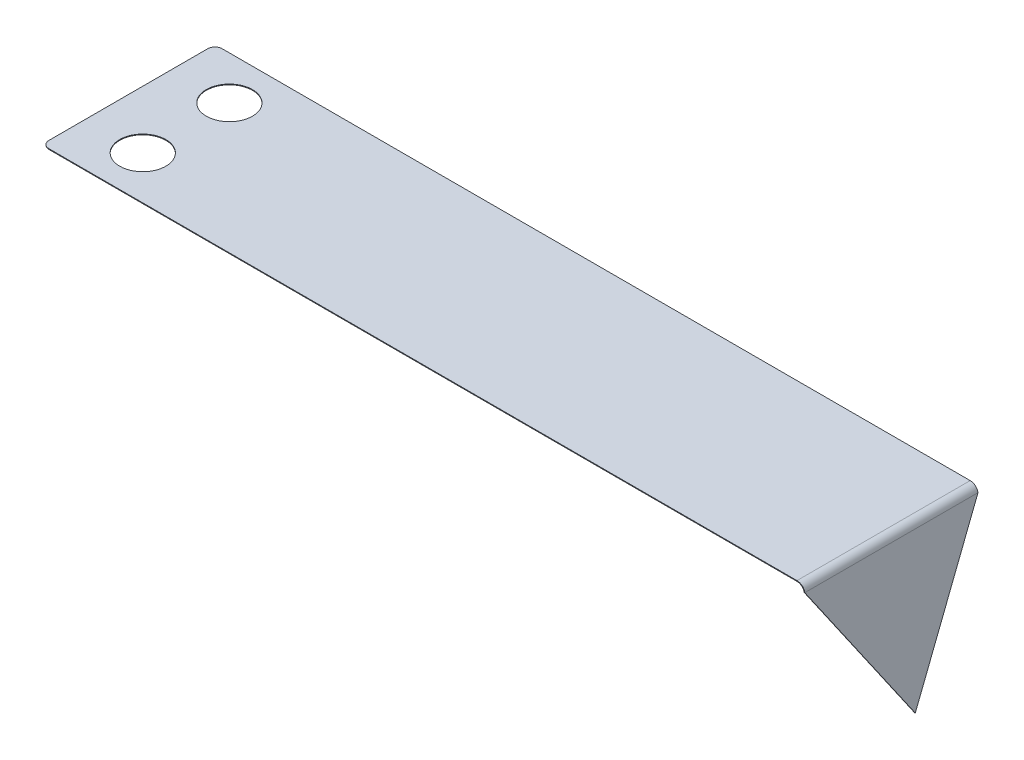
from build123d import *

# Parameters (mm, degrees)
SKETCH2_W            = 52.8
SKETCH2_H            = 12
BASE_FLANGE1_DEPTH   = 0.05
EDGE_FLANGE1_START   = -6
EDGE_FLANGE1_DEPTH   = 12
EDGE_FLANGE1_2_DEPTH = 12
CUT_EXTRUDE2_DEPTH   = 0.05
SKETCH10_R           = 1.6
CUT_EXTRUDE1_DEPTH   = 31.402652498
FILLET1_R            = 0.5


# Read off the part's stored shape, not the designer's step: Edge-Flange1
# Sheet-metal steps are written as plain solids
with BuildPart() as part:
    # Sketch2 → Base-Flange1 (new body)
    with BuildSketch(Plane(origin=(0, 0, 0), x_dir=(1, 0, 0), z_dir=(0, 1, 0))):
        Rectangle(SKETCH2_W, SKETCH2_H)
    extrude(amount=-BASE_FLANGE1_DEPTH)

    # Edge-Flange1 outline → Edge-Flange1 (cut)
    with BuildSketch(Plane.XY.offset(EDGE_FLANGE1_START)):
        with BuildLine():
            ThreePointArc((25.929678854, 0), (26.046939248, -0.012645368), (26.158807639, -0.05))
            Line((26.158807639, -0.05), (26.4, -0.05))
            Line((26.4, -0.05), (26.4, 0))
            Line((26.4, 0), (25.929678854, 0))
        make_face()
    extrude(amount=EDGE_FLANGE1_DEPTH, mode=Mode.SUBTRACT)

    # Edge-Flange1 2 outline → Edge-Flange1 2 (add)
    with BuildSketch(Plane.XY.offset(EDGE_FLANGE1_START)):
        with BuildLine():
            Line((28.127665428, -9.84807753), (26.471323118, -0.454493502))
            ThreePointArc((26.471323118, -0.454493502), (26.364910426, -0.213735999), (26.158807639, -0.05))
            Line((26.158807639, -0.05), (25.929678854, -0.05))
            ThreePointArc((25.929678854, -0.05), (26.251072659, -0.166977778), (26.42208273, -0.463175911))
            Line((26.42208273, -0.463175911), (28.07842504, -9.856759939))
            Line((28.07842504, -9.856759939), (28.127665428, -9.84807753))
        make_face()
    extrude(amount=EDGE_FLANGE1_2_DEPTH)

    # Sketch11 → Cut-Extrude2 (cut)
    with BuildSketch(Plane(origin=(25.595392091, 4.513158207, 0), x_dir=(0, 0, -1), z_dir=(0.9848077530122074, 0.17364817766693416, 0))):
        Polygon((29.405769939, -61.330580197), (0, -14.582780947), (-6, -5.044285745), (-6, -14.582780947), (-6, -69.810093397), (19.725851686, -177.227060012), (55.131621625, -168.747546812), align=None)
    cut_extrude2 = extrude(amount=-CUT_EXTRUDE2_DEPTH, mode=Mode.SUBTRACT)

    # Mirror1: Cut-Extrude2 across plane
    add(cut_extrude2.mirror(Plane.XY), mode=Mode.SUBTRACT)

    # Sketch10 → Cut-Extrude1 (cut, through all)
    with BuildSketch(Plane(origin=(0, 0, 0), x_dir=(1, 0, 0), z_dir=(0, 1, 0))):
        with Locations(Location((-22.4, 3, 0), (0, 0, 270))):
            Circle(SKETCH10_R)
        with Locations(Location((-22.4, -3, 0), (0, 0, 270))):
            Circle(SKETCH10_R)
    extrude(amount=-CUT_EXTRUDE1_DEPTH, mode=Mode.SUBTRACT)

    # Fillet1
    fillet1_edges = [part.edges().sort_by_distance(p)[0] for p in [
        (-26.4, -0.025, 6),
        (-26.4, -0.025, -6),
    ]]
    fillet(fillet1_edges, radius=FILLET1_R)


solid = part.part
